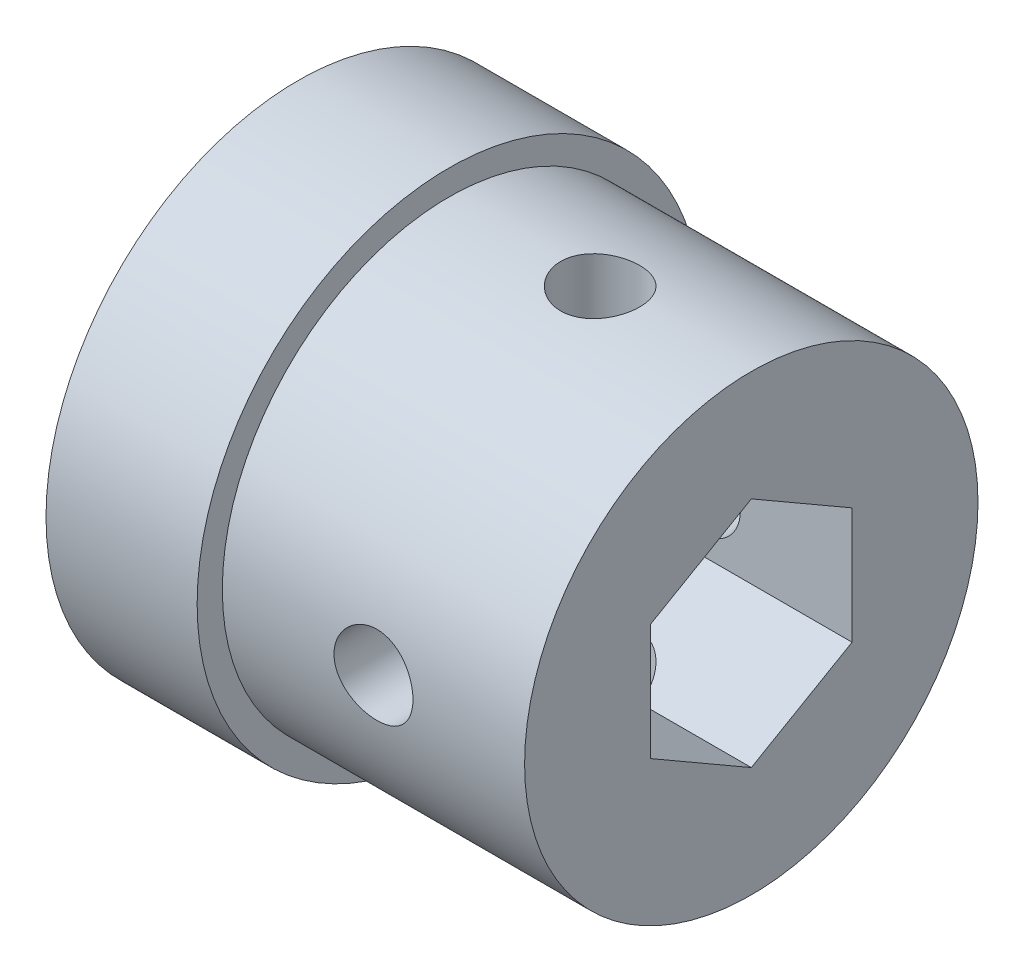
from build123d import *

# Parameters (mm, degrees)
SKETCH1_R               = 14.2875
BOSS_EXTRUDE1_DEPTH     = 19.05
SKETCH2_R               = 15.875
BOSS_EXTRUDE2_DEPTH     = 9.525
CUT_EXTRUDE1_DEPTH      = 37.339535977
CUT_EXTRUDE2_DEPTH      = 30.443738723
CUT_EXTRUDE2_DEPTH_BACK = 30.443738723
SKETCH5_R               = 2.4892
CUT_EXTRUDE3_DEPTH      = 30.443738788
CUT_EXTRUDE3_DEPTH_BACK = 30.443738788
SKETCH6_R               = 2.4892


with BuildPart() as part:
    # Sketch1 → Boss-Extrude1 (new body)
    with BuildSketch(Plane(origin=(0, 0, 0), x_dir=(0, 0, -1), z_dir=(1, 0, 0))):
        Circle(SKETCH1_R)
    extrude(amount=BOSS_EXTRUDE1_DEPTH)

    # Sketch2 → Boss-Extrude2 (add)
    with BuildSketch(Plane.ZY):
        Circle(SKETCH2_R)
    extrude(amount=BOSS_EXTRUDE2_DEPTH)

    # Sketch4 → Cut-Extrude1 (cut, through all)
    with BuildSketch(Plane.ZY.offset(9.525)):
        Polygon((0, 7.332348419), (-6.35, 3.666174209), (-6.35, -3.666174209), (0, -7.332348419), (6.35, -3.666174209), (6.35, 3.666174209), align=None)
    extrude(amount=-CUT_EXTRUDE1_DEPTH, mode=Mode.SUBTRACT)

    # Sketch5 → Cut-Extrude2 (cut, two sides: drawn at the far end of the back side and taken through both)
    with BuildSketch(Plane.XY.offset(-CUT_EXTRUDE2_DEPTH_BACK)):
        with Locations((9.525, 0)):
            Circle(SKETCH5_R)
    extrude(amount=CUT_EXTRUDE2_DEPTH + CUT_EXTRUDE2_DEPTH_BACK, mode=Mode.SUBTRACT)

    # Sketch6 → Cut-Extrude3 (cut, two sides: drawn at the far end of the back side and taken through both)
    with BuildSketch(Plane(origin=(0, 0, 0), x_dir=(1, 0, 0), z_dir=(0, 1, 0)).offset(-CUT_EXTRUDE3_DEPTH_BACK)):
        with Locations((9.525, 0)):
            Circle(SKETCH6_R)
    extrude(amount=CUT_EXTRUDE3_DEPTH + CUT_EXTRUDE3_DEPTH_BACK, mode=Mode.SUBTRACT)


solid = part.part
